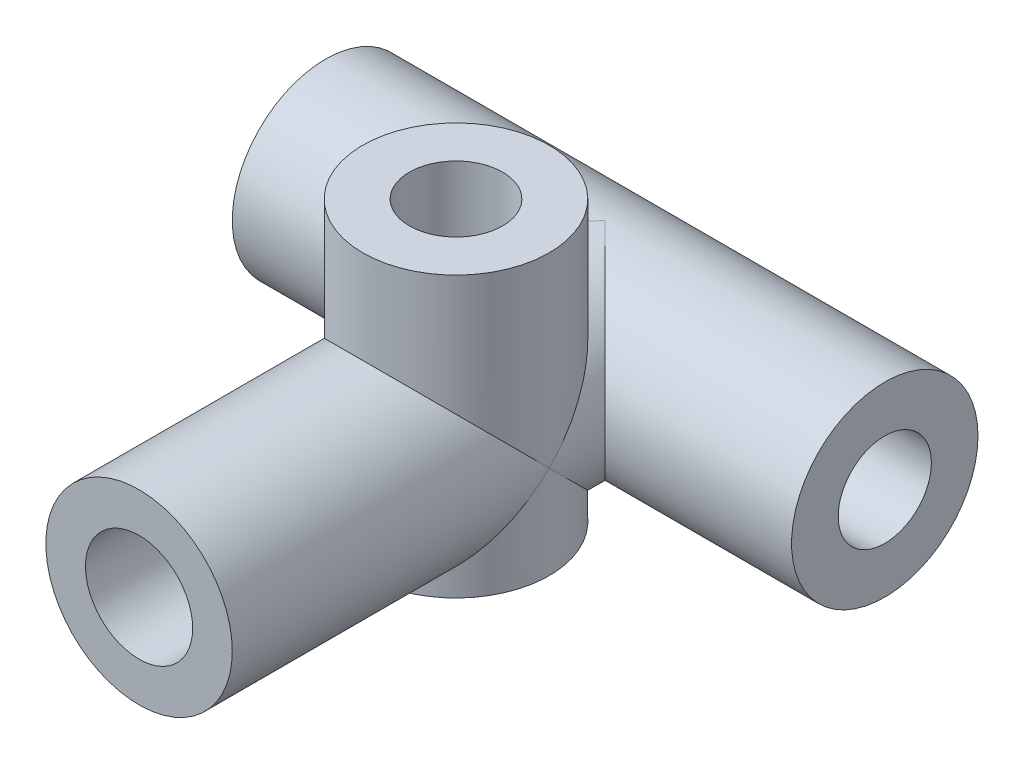
from build123d import *

# Parameters (mm, degrees)
ESQUISSE1_R                  = 2
BOSS_EXTRU_1_DEPTH           = 12
ESQUISSE5_R                  = 2
BOSS_EXTRU_4_DEPTH           = 10
ESQUISSE2_R                  = 1
ENL_V_MAT_EXTRU_1_DEPTH      = 16.748015748
BOSS_EXTRU_5_DEPTH           = 4
BOSS_EXTRU_5_DEPTH_BACK      = 2
ESQUISSE7_R                  = 2
ENL_V_MAT_EXTRU_3_REACH      = 19.436
ENL_V_MAT_EXTRU_3_END_RADIUS = 2
ESQUISSE8_R                  = 1.15
ESQUISSE9_R                  = 1
ENL_V_MAT_EXTRU_4_DEPTH      = 17.73320059
CHANFREIN1_SIZE              = 0.4
CHANFREIN1_SIZE2             = 0.335639852


with BuildPart() as part:
    # Esquisse1 → Boss.-Extru.1 (new body)
    with BuildSketch(Plane(origin=(0, 0, 0), x_dir=(0, 0, -1), z_dir=(1, 0, 0))):
        Circle(ESQUISSE1_R)
    extrude(amount=-BOSS_EXTRU_1_DEPTH)

    # Esquisse5 → Boss.-Extru.4 (add)
    with BuildSketch(Plane.XY):
        with Locations((-6, 0)):
            Circle(ESQUISSE5_R)
    extrude(amount=BOSS_EXTRU_4_DEPTH)

    # Esquisse2 → Enlèv. mat.-Extru.1 (cut, through all)
    with BuildSketch(Plane(origin=(0, 0, 0), x_dir=(0, 0, -1), z_dir=(1, 0, 0))):
        Circle(ESQUISSE2_R)
    extrude(amount=-ENL_V_MAT_EXTRU_1_DEPTH, mode=Mode.SUBTRACT)

    # Esquisse7 → Boss.-Extru.5 (add, two sides: drawn at the far end of the back side and taken through both)
    with BuildSketch(Plane(origin=(0, 0, 0), x_dir=(1, 0, 0), z_dir=(0, 1, 0)).offset(-BOSS_EXTRU_5_DEPTH_BACK)):
        with Locations((-6, -3.2)):
            Circle(ESQUISSE7_R)
    extrude(amount=BOSS_EXTRU_5_DEPTH + BOSS_EXTRU_5_DEPTH_BACK)

    # Enlèv. mat.-Extru.3: up to this cylinder (the profile starts outside it)
    enl_v_mat_extru_3_end = Plane(origin=(-6, 0, 3.2), z_dir=(0, 1, 0)) * Cylinder(ENL_V_MAT_EXTRU_3_END_RADIUS, 43.872, mode=Mode.PRIVATE)
    # Esquisse8 → Enlèv. mat.-Extru.3 (cut, up to the surface)
    with BuildSketch(Plane.XY.offset(10), mode=Mode.PRIVATE) as enl_v_mat_extru_3_sk1:
        with Locations((-6, 0)):
            Circle(ESQUISSE8_R)
    enl_v_mat_extru_3_tool1 = extrude(enl_v_mat_extru_3_sk1.sketch, amount=-ENL_V_MAT_EXTRU_3_REACH, mode=Mode.PRIVATE) - enl_v_mat_extru_3_end
    add(enl_v_mat_extru_3_tool1.solids().sort_by_distance((-6, 0, 10))[0], mode=Mode.SUBTRACT)

    # Esquisse9 → Enlèv. mat.-Extru.4 (cut, through all)
    with BuildSketch(Plane(origin=(0, 4, 0), x_dir=(1, 0, 0), z_dir=(0, 1, 0))):
        with Locations((-6, -3.2)):
            Circle(ESQUISSE9_R)
    extrude(amount=-ENL_V_MAT_EXTRU_4_DEPTH, mode=Mode.SUBTRACT)

    # Chanfrein1
    chanfrein1_edges = [part.edges().sort_by_distance(p)[0] for p in [
        (-7, -2, 3.2),
    ]]
    chanfrein1_side = [part.faces().sort_by_distance(p)[0] for p in [
        (-7, 1, 3.2),
    ]]
    chamfer(chanfrein1_edges, length=CHANFREIN1_SIZE, length2=CHANFREIN1_SIZE2, reference=chanfrein1_side[0])


solid = part.part
